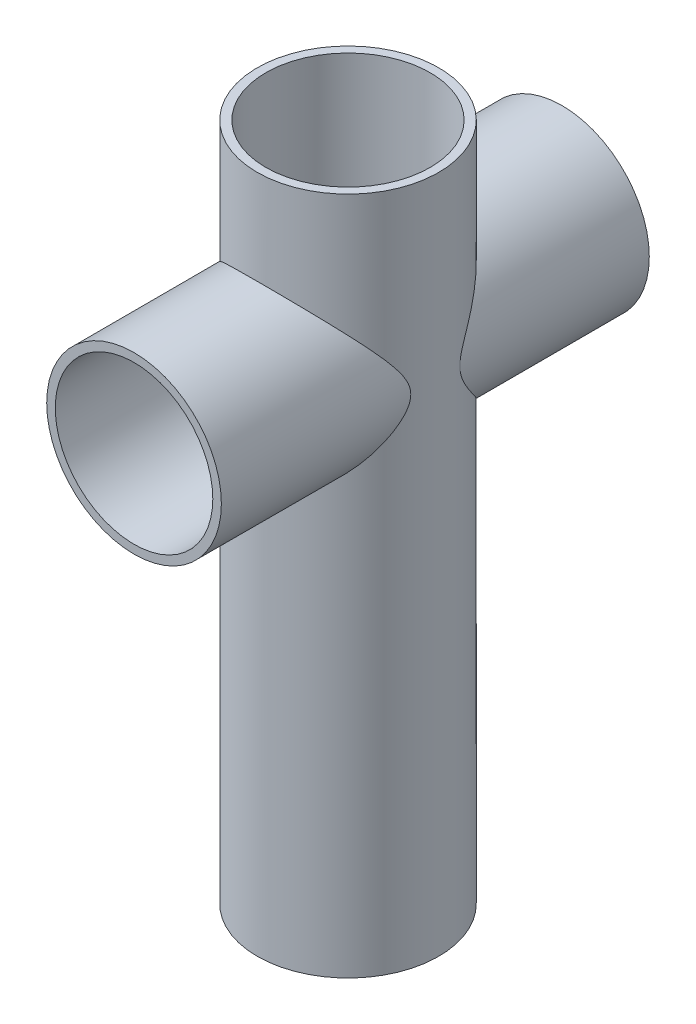
from build123d import *
from OCP.BRepAlgoAPI import BRepAlgoAPI_Cut
from OCP.TopTools import TopTools_ListOfShape

# Parameters (mm, degrees)
SKETCH7_R           = 21.1979112
BOSS_EXTRUDE1_DEPTH = 180.647627
SKETCH12_R          = 20.406966807
BOSS_EXTRUDE6_DEPTH = 50
SHELL1_START        = -50
SHELL1_OUTLINE_R    = 18.406966807
SHELL1_DEPTH        = 100
SHELL1_2_OUTLINE_R  = 19.1979112
SHELL1_2_DEPTH      = 178.6476265
CUT_EXTRUDE1_START  = -22
SKETCH13_R          = 21.1979112
CUT_EXTRUDE1_DEPTH  = 22


with BuildPart() as part:
    # Sketch7 → Boss-Extrude1 (new body)
    with BuildSketch(Plane(origin=(0, 0, 0), x_dir=(1, 0, 0), z_dir=(0, 1, 0))):
        with Locations(Location((0, 0, 0), (0, 0, 270))):
            Circle(SKETCH7_R)
    extrude(amount=BOSS_EXTRUDE1_DEPTH)

    # Sketch12 → Boss-Extrude6 (add, symmetric)
    with BuildSketch(Plane.XY):
        with Locations((0, 116.195122616)):
            Circle(SKETCH12_R)
    extrude(amount=BOSS_EXTRUDE6_DEPTH, both=True)

    # Shell1: read off the stored shape, not the designer's step
    # Shell1 outline → Shell1 (cut)
    with BuildSketch(Plane.XY.offset(SHELL1_START)):
        with Locations((0, 116.195122616)):
            Circle(SHELL1_OUTLINE_R)
    extrude(amount=SHELL1_DEPTH, mode=Mode.SUBTRACT)

    # Shell1 2 outline → Shell1 2 (cut)
    with BuildSketch(Plane(origin=(0, 0, 0), x_dir=(1, 0, 0), z_dir=(0, 1, 0))):
        Circle(SHELL1_2_OUTLINE_R)
    extrude(amount=SHELL1_2_DEPTH, mode=Mode.SUBTRACT)


with BuildPart() as cut_extrude1_tool:
    # Sketch13 → Cut-Extrude1 (new body)
    with BuildSketch(Plane(origin=(0, 180.6476265, 0), x_dir=(1, 0, 0), z_dir=(0, 1, 0)).offset(CUT_EXTRUDE1_START)):
        with Locations(Location((0, 0, 0), (0, 0, 270))):
            Circle(SKETCH13_R)
    extrude(amount=CUT_EXTRUDE1_DEPTH)


with BuildPart() as part_1:
    add(part.part)

    # Cut-Extrude1: cut by cut_extrude1_tool, with a tolerance
    cut_extrude1_stock = TopTools_ListOfShape()
    cut_extrude1_stock.Append(part_1.part.wrapped)
    cut_extrude1_tools = TopTools_ListOfShape()
    cut_extrude1_tools.Append(cut_extrude1_tool.part.wrapped)
    cut_extrude1_cut = BRepAlgoAPI_Cut()
    cut_extrude1_cut.SetArguments(cut_extrude1_stock)
    cut_extrude1_cut.SetTools(cut_extrude1_tools)
    cut_extrude1_cut.SetFuzzyValue(0.00001)
    cut_extrude1_cut.Build()
    add(Compound.cast(cut_extrude1_cut.Shape()).solids(), mode=Mode.REPLACE)


solid = part_1.part
